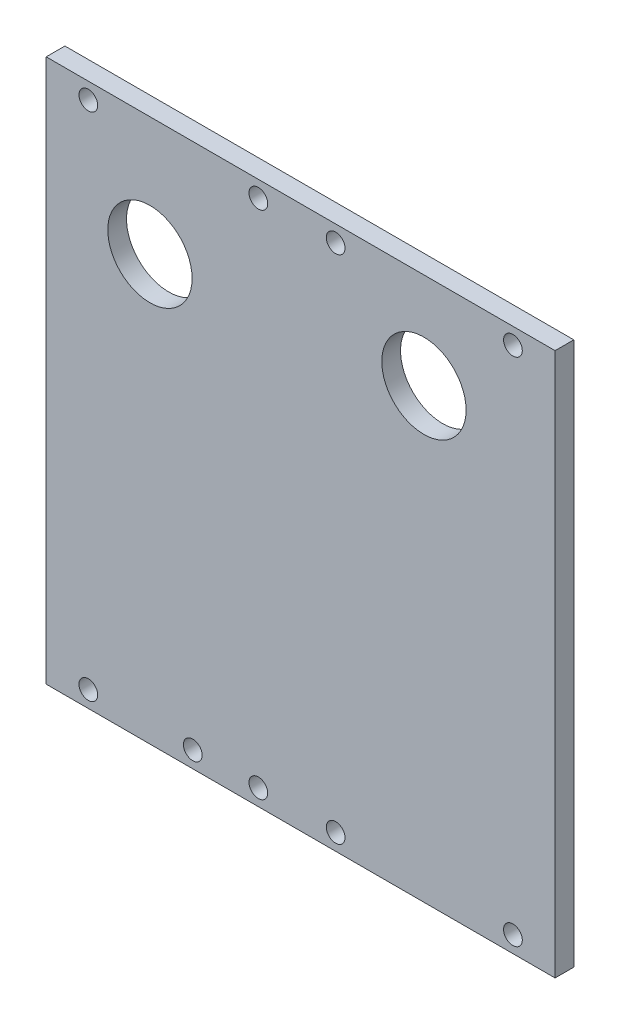
from build123d import *

# Parameters (mm, degrees)
SKETCH1_W           = 108.65
SKETCH1_H           = 116
BOSS_EXTRUDE1_DEPTH = 4
SKETCH2_R           = 9
CUT_EXTRUDE1_DEPTH  = 80.568873468
SKETCH4_R           = 2
CUT_EXTRUDE2_DEPTH  = 80.568873468


with BuildPart() as part:
    # Sketch1 → Boss-Extrude1 (new body)
    with BuildSketch(Plane.XY):
        Rectangle(SKETCH1_W, SKETCH1_H)
    extrude(amount=BOSS_EXTRUDE1_DEPTH)

    # Sketch2 → Cut-Extrude1 (cut, through all)
    with BuildSketch(Plane.XY.offset(4)):
        with Locations((26.325, 37.5)):
            Circle(SKETCH2_R)
        with Locations((-32.175, 32.6)):
            Circle(SKETCH2_R)
    extrude(amount=-CUT_EXTRUDE1_DEPTH, mode=Mode.SUBTRACT)

    # Sketch4 → Cut-Extrude2 (cut, through all)
    with BuildSketch(Plane.XY.offset(4)):
        with Locations((-45.325, 54.5)):
            Circle(SKETCH4_R)
        with Locations((-45.325, -54.5)):
            Circle(SKETCH4_R)
        with Locations((-9.025, 54.5)):
            Circle(SKETCH4_R)
        with Locations((-9.025, -54.5)):
            Circle(SKETCH4_R)
        with Locations((-23.025, -54.5)):
            Circle(SKETCH4_R)
        with Locations((7.475, 54.5)):
            Circle(SKETCH4_R)
        with Locations((7.475, -54.5)):
            Circle(SKETCH4_R)
        with Locations((45.325, 54.5)):
            Circle(SKETCH4_R)
        with Locations((45.325, -54.5)):
            Circle(SKETCH4_R)
    extrude(amount=-CUT_EXTRUDE2_DEPTH, mode=Mode.SUBTRACT)


solid = part.part
